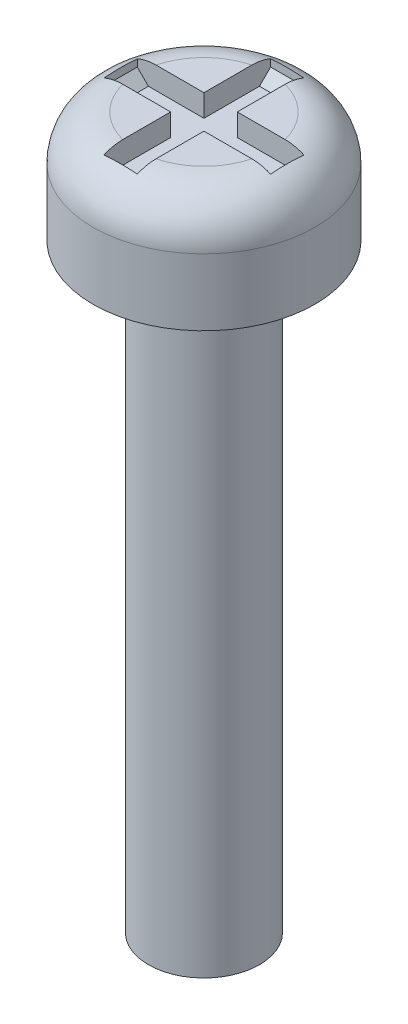
from build123d import *

# Parameters (mm, degrees)
SKETCH1_R           = 2
BOSS_EXTRUDE1_DEPTH = 2
FILLET1_R           = 0.8
CUT_EXTRUDE1_DEPTH  = 0.4
CHAMFER1_SIZE       = 0.2
SKETCH3_R           = 1
BOSS_EXTRUDE2_DEPTH = 10.8


with BuildPart() as part:
    # Sketch1 → Boss-Extrude1 (new body)
    with BuildSketch(Plane(origin=(0, 0, 0), x_dir=(1, 0, 0), z_dir=(0, 1, 0))):
        Circle(SKETCH1_R)
    extrude(amount=BOSS_EXTRUDE1_DEPTH)

    # Fillet1
    fillet1_edges = [part.edges().sort_by_distance(p)[0] for p in [
        (-2, 2, 0),
    ]]
    fillet(fillet1_edges, radius=FILLET1_R)

    # Sketch2 → Cut-Extrude1 (cut)
    with BuildSketch(Plane(origin=(0, 2, 0), x_dir=(1, 0, 0), z_dir=(0, 1, 0))):
        Polygon((-1.5, 0.3), (-1.5, -0.3), (-0.3, -0.3), (-0.3, -1.5), (0.3, -1.5), (0.3, -0.3), (1.5, -0.3), (1.5, 0.3), (0.3, 0.3), (0.3, 1.5), (-0.3, 1.5), (-0.3, 0.3), align=None)
    extrude(amount=-CUT_EXTRUDE1_DEPTH, mode=Mode.SUBTRACT)

    # Chamfer1
    chamfer1_edges = [part.edges().sort_by_distance(p)[0] for p in [
        (0, 1.6, 1.5),
        (1.5, 1.6, 0),
        (-1.5, 1.6, 0),
        (0, 1.6, -1.5),
    ]]
    chamfer(chamfer1_edges, length=CHAMFER1_SIZE)

    # Sketch3 → Boss-Extrude2 (add)
    with BuildSketch(Plane.XZ):
        Circle(SKETCH3_R)
    extrude(amount=BOSS_EXTRUDE2_DEPTH)


solid = part.part
